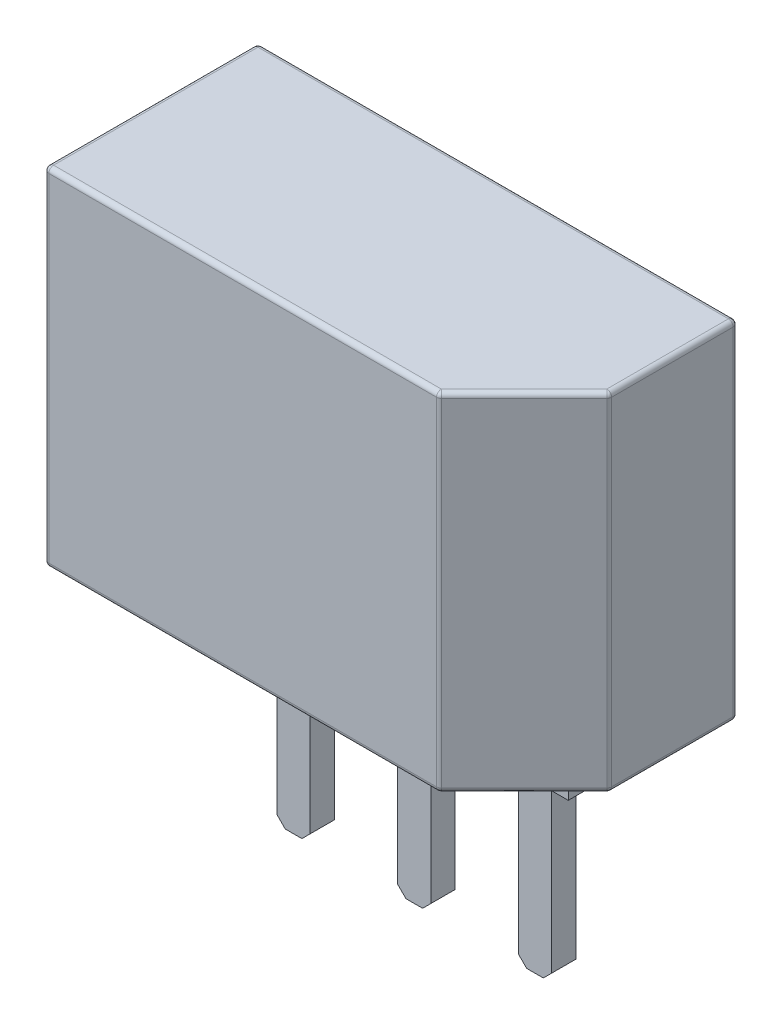
from build123d import *

# Parameters (mm, degrees)
SKIZZE1_W                       = 10.1
SKIZZE1_H                       = 4.5
AUFSATZ_LINEAR_AUSTRAGEN1_DEPTH = 7.3
FASE2_SIZE                      = 1.8
AUFSATZ_LINEAR_AUSTRAGEN2_DEPTH = 0.255
LINEARES_MUSTER1_COUNT          = 2
LINEARES_MUSTER1_PITCH          = 2.54
LINEARES_MUSTER1_COUNT_DIR2     = 2
LINEARES_MUSTER1_PITCH_DIR2     = 2.54
VERRUNDUNG1_R                   = 0.1


with BuildPart() as part:
    # Skizze1 → Aufsatz-Linear austragen1 (new body)
    with BuildSketch(Plane(origin=(0, 0, 0), x_dir=(1, 0, 0), z_dir=(0, 1, 0))):
        Rectangle(SKIZZE1_W, SKIZZE1_H)
    extrude(amount=AUFSATZ_LINEAR_AUSTRAGEN1_DEPTH)

    # Fase2
    fase2_edges = [part.edges().sort_by_distance(p)[0] for p in [
        (5.05, 3.65, 2.25),
    ]]
    chamfer(fase2_edges, length=FASE2_SIZE)

    # Skizze3 → Aufsatz-Linear austragen2 (add, symmetric)
    with BuildSketch(Plane.XY.offset(-0.745)):
        Polygon((-0.7, 0), (0.7, 0), (0.7, -1.5), (0.35, -1.5), (0.35, -4.825), (0.175, -5), (-0.175, -5), (-0.35, -4.825), (-0.35, -1.5), (-0.7, -1.5), align=None)
    aufsatz_linear_austragen2 = extrude(amount=AUFSATZ_LINEAR_AUSTRAGEN2_DEPTH, both=True)

    # Lineares Muster1: Aufsatz-Linear austragen2 2 × 2
    with Locations(*[Vector(1, 0, 0) * (i * LINEARES_MUSTER1_PITCH) + Vector(-1, 0, 0) * (j * LINEARES_MUSTER1_PITCH_DIR2) for i in range(LINEARES_MUSTER1_COUNT) for j in range(LINEARES_MUSTER1_COUNT_DIR2) if (i, j) != (0, 0)]):
        add(aufsatz_linear_austragen2)

    # Verrundung1
    verrundung1_edges = [part.edges().sort_by_distance(p)[0] for p in [
        (5.05, 3.65, -2.25),
        (-5.05, 3.65, -2.25),
        (-5.05, 3.65, 2.25),
        (-5.05, 7.3, 0),
        (0, 7.3, -2.25),
        (5.05, 7.3, -0.9),
        (-0.9, 7.3, 2.25),
        (2.54, 0, -0.49),
        (1.84, 0, -0.745),
        (2.54, 0, -1),
        (3.24, 0, -0.745),
        (0, 0, -0.49),
        (-0.7, 0, -0.745),
        (0, 0, -1),
        (0.7, 0, -0.745),
        (0, 0, -2.25),
        (-5.05, 0, 0),
        (-0.9, 0, 2.25),
        (5.05, 0, -0.9),
        (-2.54, 0, -0.49),
        (-3.24, 0, -0.745),
        (-2.54, 0, -1),
        (-1.84, 0, -0.745),
        (5.05, 3.65, 0.45),
        (4.15, 0, 1.35),
        (3.25, 3.65, 2.25),
        (4.15, 7.3, 1.35),
    ]]
    fillet(verrundung1_edges, radius=VERRUNDUNG1_R)


solid = part.part
